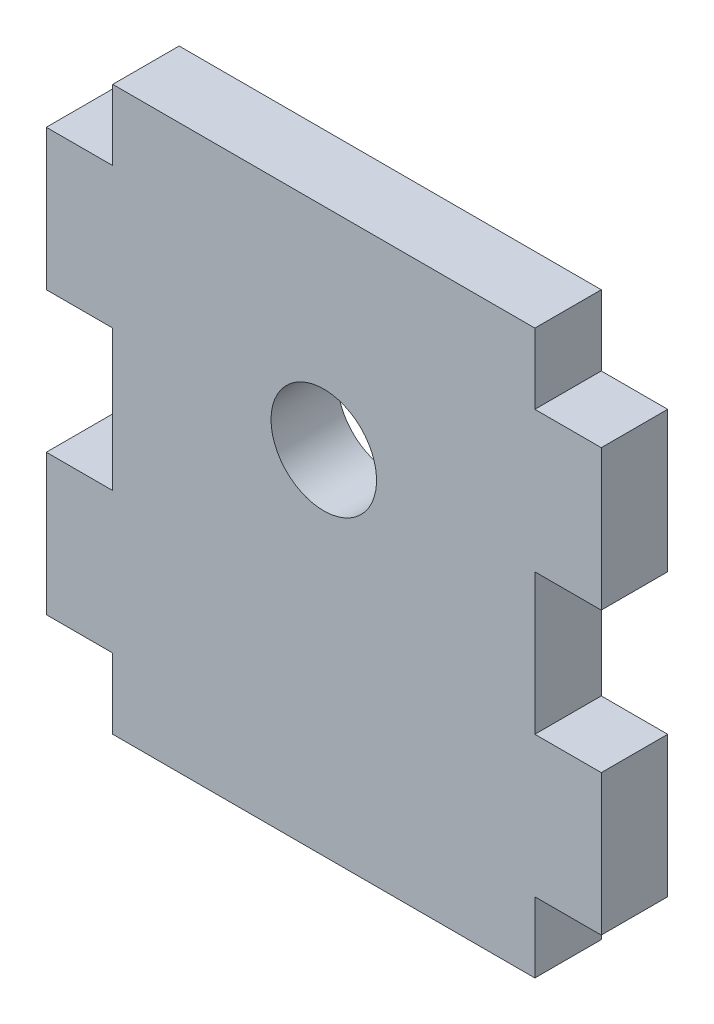
from build123d import *

# Parameters (mm, degrees)
BOSS_EXTRUDE1_DEPTH = 5.9944
SKETCH2_R           = 4.7625
CUT_EXTRUDE1_DEPTH  = 68.534353797


with BuildPart() as part:
    # Sketch1 → Boss-Extrude1 (new body)
    with BuildSketch(Plane.XY):
        Polygon((0, 0), (-38.1, 0), (-38.1, 6.35), (-44.0944, 6.35), (-44.0944, 19.05), (-38.1, 19.05), (-38.1, 31.75), (-44.0944, 31.75), (-44.0944, 44.45), (-38.1, 44.45), (-38.1, 50.8), (0, 50.8), (0, 44.45), (5.9944, 44.45), (5.9944, 31.75), (0, 31.75), (0, 19.05), (5.9944, 19.05), (5.9944, 6.35), (0, 6.35), align=None)
    extrude(amount=BOSS_EXTRUDE1_DEPTH)

    # Sketch2 → Cut-Extrude1 (cut, through all)
    with BuildSketch(Plane(origin=(0, 0, 0), x_dir=(-1, 0, 0), z_dir=(0, 0, -1))):
        with Locations((19.05, 31.75)):
            Circle(SKETCH2_R)
    extrude(amount=-CUT_EXTRUDE1_DEPTH, mode=Mode.SUBTRACT)


solid = part.part
